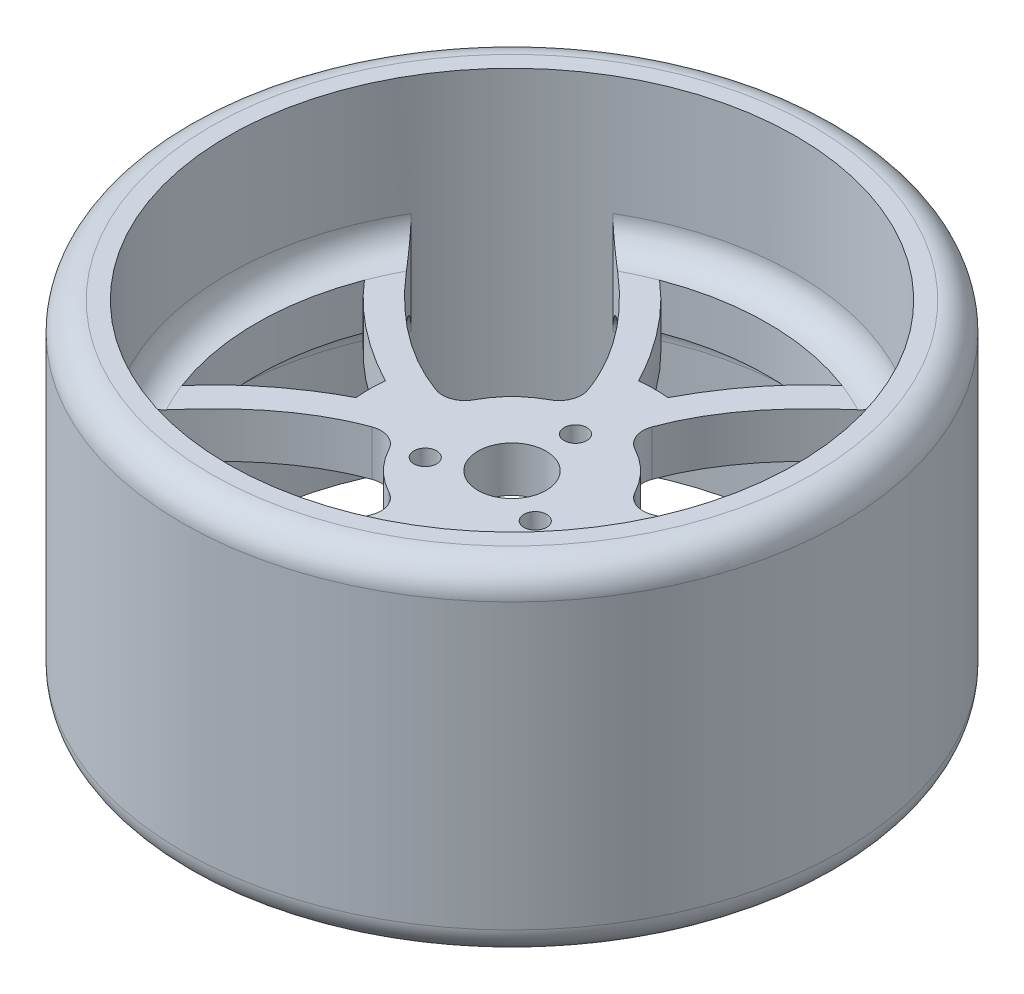
from build123d import *

# Parameters (mm, degrees)
SKETCH1_R           = 8
SKETCH1_R_2         = 3.0000000000000004
BOSS_EXTRUDE1_DEPTH = 2
BOSS_EXTRUDE2_DEPTH = 2
SKETCH3_R           = 29
SKETCH3_R_2         = 25
BOSS_EXTRUDE3_DEPTH = 15
FILLET4_R           = 2
FILLET5_R           = 2.5
FILLET6_R           = 2.5
FILLET7_R           = 2.5
SKETCH4_R           = 1
SKETCH4_R_2         = 0.9999999999999998
SKETCH4_R_3         = 1.0000000000000002
CUT_EXTRUDE1_DEPTH  = 2


with BuildPart() as part:
    # Sketch1 → Boss-Extrude1 (new, symmetric)
    with BuildSketch(Plane(origin=(0, 0, 0), x_dir=(1, 0, 0), z_dir=(0, 1, 0))):
        with Locations(Location((0, 0, 0), (0, 0, 270))):
            Circle(SKETCH1_R)
        with Locations(Location((0, 0, 0), (0, 0, 270))):
            Circle(SKETCH1_R_2, mode=Mode.SUBTRACT)
    extrude(amount=BOSS_EXTRUDE1_DEPTH, both=True)

    # Sketch2 → Boss-Extrude2 (add, symmetric)
    # profile 1 of 4: a face of its own
    with BuildSketch(Plane(origin=(0, 0, 0), x_dir=(1, 0, 0), z_dir=(0, 1, 0))):
        with BuildLine():
            ThreePointArc((2.2695809670863323, 7.671310333563589), (8.709421322e-08, 8), (-2.269580800054647, 7.6713103829804306))
            add(Edge.make_bspline(
                [(-12.67089820780367, 21.551063514533983), (-4.013865804205003, 15.009227186177714), (-2.269580800054647, 7.6713103829804306)],
                knots=[0, 0, 0, 0.24224391865974262, 0.24224391865974262, 0.24224391865974262], degree=2))
            ThreePointArc((-12.67089820780367, 21.551063514533983), (1.53e-15, 25), (12.67089820780367, 21.551063514533983))
            add(Edge.make_bspline(
                [(12.67089820780367, 21.551063514533983), (4.013865971236688, 15.00922713676088), (2.2695809670863323, 7.671310333563589)],
                knots=[0, 0, 0, 0.24224391865974262, 0.24224391865974262, 0.24224391865974262], degree=2))
        make_face()
        with BuildLine():
            ThreePointArc((1.2818712160915144, 12.434098527249818), (4.517e-14, 12.500000000000002), (-1.2818712160914238, 12.434098527249807))
            add(Edge.make_bspline(
                [(-1.2818712160914238, 12.434098527249807), (-3.998573767997333, 17.569592263132947), (-8.03023309479023, 21.018214872898533)],
                knots=[0, 0, 0, 0.40797739644843595, 0.40797739644843595, 0.40797739644843595], degree=2))
            ThreePointArc((-8.03023309479023, 21.018214872898533), (1.38e-15, 22.5), (8.03023309479026, 21.018214872898586))
            add(Edge.make_bspline(
                [(1.2818712160915144, 12.434098527249818), (3.998573767997333, 17.569592263132947), (8.03023309479026, 21.018214872898586)],
                knots=[0, 0, 0, 0.40797739644843595, 0.40797739644843595, 0.40797739644843595], degree=2))
        make_face(mode=Mode.SUBTRACT)
    # profile 2 of 4: a face of its own
    with BuildSketch(Plane(origin=(0, 0, 0), x_dir=(1, 0, 0), z_dir=(0, 1, 0))):
        with BuildLine():
            ThreePointArc((7.671310333739337, -2.2695809664922972), (8.000000000000002, -8.647472605e-08), (7.671310382804682, 2.2695808006486815))
            add(Edge.make_bspline(
                [(21.5510635135528, 12.670898209472497), (15.00922718600197, 4.013865804799012), (7.671310382804682, 2.2695808006486815)],
                knots=[0, 0, 0, 0.24224391865974262, 0.24224391865974262, 0.24224391865974262], degree=2))
            ThreePointArc((21.5510635135528, 12.670898209472497), (25.000000000000004, 1.93589866e-09), (21.551063515515168, -12.670898206134844))
            add(Edge.make_bspline(
                [(21.551063515515168, -12.670898206134844), (15.009227136936637, -4.013865970642688), (7.671310333739337, -2.2695809664922972)],
                knots=[0, 0, 0, 0.24224391865974262, 0.24224391865974262, 0.24224391865974262], degree=2))
        make_face()
        with BuildLine():
            ThreePointArc((21.01821487289856, -8.030233094790333), (22.500000000000004, -8.368e-14), (21.01821487289856, 8.030233094790155))
            add(Edge.make_bspline(
                [(12.434098527249812, 1.2818712160913803), (17.56959226313297, 3.9985737679972475), (21.01821487289856, 8.030233094790155)],
                knots=[0, 0, 0, 0.40797739644843595, 0.40797739644843595, 0.40797739644843595], degree=2))
            ThreePointArc((12.434098527249812, 1.2818712160913803), (12.5, -8.83e-14), (12.434098527249812, -1.2818712160915577))
            add(Edge.make_bspline(
                [(12.434098527249812, -1.2818712160915577), (17.569592263132925, -3.9985737679974176), (21.01821487289856, -8.030233094790333)],
                knots=[0, 0, 0, 0.40797739644843595, 0.40797739644843595, 0.40797739644843595], degree=2))
        make_face(mode=Mode.SUBTRACT)
    # profile 3 of 4: a face of its own
    with BuildSketch(Plane(origin=(0, 0, 0), x_dir=(1, 0, 0), z_dir=(0, 1, 0))):
        with BuildLine():
            ThreePointArc((-2.2695809658982626, -7.671310333915083), (-8.585523887e-08, -8), (2.2695808012427166, -7.671310382628936))
            add(Edge.make_bspline(
                [(12.67089821114132, -21.55106351257162), (4.013865805393022, -15.009227185826232), (2.2695808012427166, -7.671310382628936)],
                knots=[0, 0, 0, 0.24224391865974262, 0.24224391865974262, 0.24224391865974262], degree=2))
            ThreePointArc((12.67089821114132, -21.55106351257162), (3.87179331e-09, -25.000000000000004), (-12.670898204466019, -21.55106351649635))
            add(Edge.make_bspline(
                [(-12.670898204466019, -21.55106351649635), (-4.01386597004867, -15.009227137112411), (-2.2695809658982626, -7.671310333915083)],
                knots=[0, 0, 0, 0.24224391865974262, 0.24224391865974262, 0.24224391865974262], degree=2))
        make_face()
        with BuildLine():
            ThreePointArc((-8.030233094790407, -21.018214872898536), (-1.6349e-13, -22.500000000000007), (8.03023309479008, -21.01821487289859))
            add(Edge.make_bspline(
                [(1.281871216091337, -12.43409852724982), (3.998573767997162, -17.569592263132993), (8.03023309479008, -21.01821487289859)],
                knots=[0, 0, 0, 0.40797739644843595, 0.40797739644843595, 0.40797739644843595], degree=2))
            ThreePointArc((1.281871216091337, -12.43409852724982), (-1.3246e-13, -12.500000000000005), (-1.2818712160916013, -12.434098527249812))
            add(Edge.make_bspline(
                [(-1.2818712160916013, -12.434098527249812), (-3.9985737679975033, -17.569592263132904), (-8.030233094790407, -21.018214872898536)],
                knots=[0, 0, 0, 0.40797739644843595, 0.40797739644843595, 0.40797739644843595], degree=2))
        make_face(mode=Mode.SUBTRACT)
    # profile 4 of 4: a face of its own
    with BuildSketch(Plane(origin=(0, 0, 0), x_dir=(1, 0, 0), z_dir=(0, 1, 0))):
        with BuildLine():
            ThreePointArc((-7.671310334090831, 2.269580965304228), (-8.000000000000002, 8.523575188e-08), (-7.6713103824531865, -2.269580801836752))
            add(Edge.make_bspline(
                [(-21.551063511590435, -12.670898212810153), (-15.009227185650488, -4.013865805987031), (-7.6713103824531865, -2.269580801836752)],
                knots=[0, 0, 0, 0.24224391865974262, 0.24224391865974262, 0.24224391865974262], degree=2))
            ThreePointArc((-21.551063511590435, -12.670898212810153), (-25, -5.8076846e-09), (-21.55106351747753, 12.670898202797192))
            add(Edge.make_bspline(
                [(-21.55106351747753, 12.670898202797192), (-15.009227137288157, 4.013865969454661), (-7.671310334090831, 2.269580965304228)],
                knots=[0, 0, 0, 0.24224391865974262, 0.24224391865974262, 0.24224391865974262], degree=2))
        make_face()
        with BuildLine():
            ThreePointArc((-21.018214872898504, 8.03023309479048), (-22.500000000000004, 2.4256e-13), (-21.018214872898614, -8.030233094790008))
            add(Edge.make_bspline(
                [(-12.434098527249821, -1.2818712160912935), (-17.569592263133018, -3.998573767997074), (-21.018214872898614, -8.030233094790008)],
                knots=[0, 0, 0, 0.40797739644843595, 0.40797739644843595, 0.40797739644843595], degree=2))
            ThreePointArc((-12.434098527249821, -1.2818712160912935), (-12.5, 1.7917e-13), (-12.434098527249803, 1.2818712160916448))
            add(Edge.make_bspline(
                [(-12.434098527249803, 1.2818712160916448), (-17.569592263132883, 3.9985737679975926), (-21.018214872898504, 8.03023309479048)],
                knots=[0, 0, 0, 0.40797739644843595, 0.40797739644843595, 0.40797739644843595], degree=2))
        make_face(mode=Mode.SUBTRACT)
    extrude(amount=BOSS_EXTRUDE2_DEPTH, both=True)

    # Sketch3 → Boss-Extrude3 (add, symmetric)
    with BuildSketch(Plane(origin=(0, 0, 0), x_dir=(1, 0, 0), z_dir=(0, 1, 0))):
        with Locations(Location((0, 0, 0), (0, 0, 270))):
            Circle(SKETCH3_R)
        with Locations(Location((0, 0, 0), (0, 0, 270))):
            Circle(SKETCH3_R_2, mode=Mode.SUBTRACT)
    extrude(amount=BOSS_EXTRUDE3_DEPTH, both=True)

    # Fillet4
    fillet4_edges = [part.edges().sort_by_distance(p)[0] for p in [
        (2.2695809670863323, -1, -7.671310333563589),
        (7.671310382804682, -1, -2.269580800648682),
        (2.269580801242716, -1, 7.671310382628937),
        (7.671310333739338, 1, 2.2695809664922972),
        (-2.2695809658982626, 1, 7.671310333915084),
        (-7.6713103824531865, 1, 2.269580801836752),
        (-7.671310334090831, 1, -2.269580965304228),
        (-2.2695808000546474, 1, -7.671310382980431),
    ]]
    fillet(fillet4_edges, radius=FILLET4_R)

    # Fillet5
    fillet5_edges = [part.edges().sort_by_distance(p)[0] for p in [
        (6.56595050947362, 2, 24.12236086926699),
        (25, 2, -1.93590255e-09),
        (-4.4e-16, 2, -25),
        (-24.999999999999993, 2, 5.80769388e-09),
    ]]
    fillet(fillet5_edges, radius=FILLET5_R - 0.0001)  # a hair under: the kernel refuses the full size

    # Fillet6
    fillet6_edges = [part.edges().sort_by_distance(p)[0] for p in [
        (-4.4e-16, -2, -25),
        (-24.999999999999993, -2, 5.80769388e-09),
        (6.56595050947362, -2, 24.12236086926699),
        (25, -2, -1.93590255e-09),
    ]]
    fillet(fillet6_edges, radius=FILLET6_R - 0.0001)  # a hair under: the kernel refuses the full size

    # Fillet7
    fillet7_edges = [part.edges().sort_by_distance(p)[0] for p in [
        (8.88e-15, 15, -29),
        (8.88e-15, -15, -29),
    ]]
    fillet(fillet7_edges, radius=FILLET7_R)

    # Sketch4 → Cut-Extrude1 (cut, symmetric)
    with BuildSketch(Plane(origin=(0, 0, 0), x_dir=(1, 0, 0), z_dir=(0, 1, 0))):
        with Locations(Location((0, 5.588815508042424, 0), (0, 0, 270))):
            Circle(SKETCH4_R)
        with Locations(Location((4.840056207029408, -2.7944077540210768, 0), (0, 0, 270))):
            Circle(SKETCH4_R_2)
        with Locations(Location((-4.8400562070289395, -2.7944077540213494, 0), (0, 0, 270))):
            Circle(SKETCH4_R_3)
    extrude(amount=CUT_EXTRUDE1_DEPTH, both=True, mode=Mode.SUBTRACT)


solid = part.part
